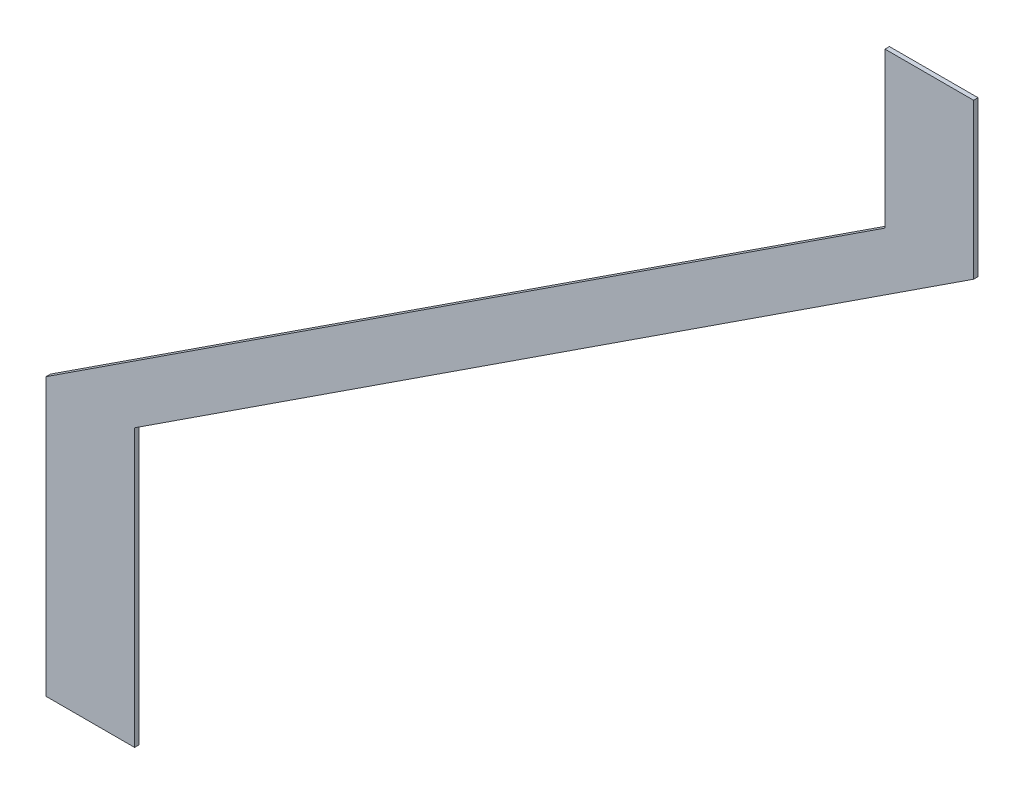
from build123d import *

# Parameters (mm, degrees)
SM_BASE_FLANGE_1_DEPTH = 4


# Sheet-metal steps are written as plain solids
with BuildPart() as part:
    # 草图8 → 基体-法兰1 (new body)
    with BuildSketch(Plane.XY):
        Polygon((-1072.352889995, 0), (-1830, -495), (-1830, -745), (-1750, -745), (-1750, -495), (-992.352889995, 0), (-992.352889995, 140), (-1072.352889995, 140), align=None)
    extrude(amount=-SM_BASE_FLANGE_1_DEPTH)


solid = part.part
